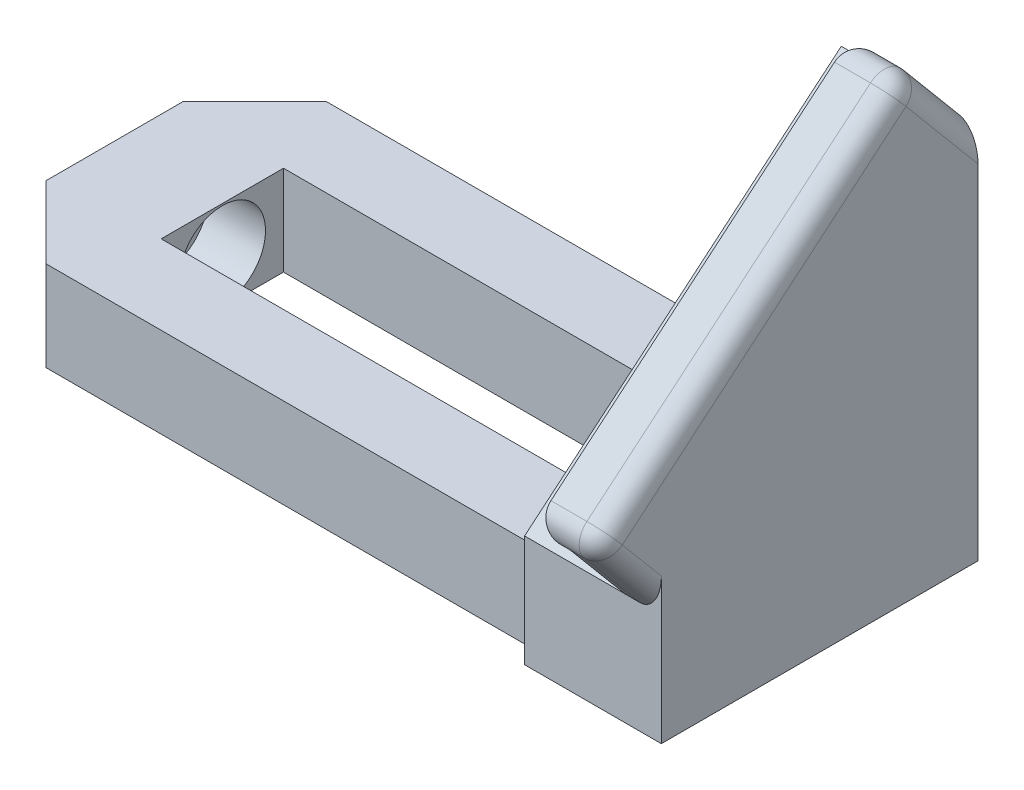
from build123d import *

# Parameters (mm, degrees)
SKETCH1_W                = 64
SKETCH1_H                = 17
BOSS_EXTRUDE1_DEPTH      = 12.5
SKETCH2_R                = 6
CUT_EXTRUDE1_DEPTH       = 8
BOSS_EXTRUDE2_DEPTH      = 3
BOSS_EXTRUDE2_DEPTH_BACK = 12.5
SKETCH3_W                = 19
SKETCH3_H                = 44
BOSS_EXTRUDE3_DEPTH      = 19
BOSS_EXTRUDE4_DEPTH      = 57.437921
FILLET2_R                = 0.5
FILLET3_R                = 3


with BuildPart() as part:
    # Sketch1 → Boss-Extrude1 (new body)
    with BuildSketch(Plane(origin=(0, 0, 0), x_dir=(1, 0, 0), z_dir=(0, 1, 0))):
        Polygon((0, 39), (-88, 39), (-98, 29), (-98, 10), (-88, 0), (0, 0), align=None)
        with Locations((-51, 19.5)):
            Rectangle(SKETCH1_W, SKETCH1_H, mode=Mode.SUBTRACT)
    extrude(amount=BOSS_EXTRUDE1_DEPTH)

    # Sketch2 → Cut-Extrude1 (cut)
    with BuildSketch(Plane(origin=(-83, 0, 0), x_dir=(0, 0, -1), z_dir=(1, 0, 0))):
        with Locations((19.5, 6.25)):
            Circle(SKETCH2_R)
    extrude(amount=-CUT_EXTRUDE1_DEPTH, mode=Mode.SUBTRACT)

    # Sketch3 → Boss-Extrude2 (add, two sides: drawn at the far end of the back side and taken through both)
    with BuildSketch(Plane(origin=(0, 12.5, 0), x_dir=(1, 0, 0), z_dir=(0, 1, 0)).offset(-BOSS_EXTRUDE2_DEPTH_BACK)):
        with Locations((-9.5, 19.5)):
            Rectangle(SKETCH3_W, SKETCH3_H)
    extrude(amount=BOSS_EXTRUDE2_DEPTH + BOSS_EXTRUDE2_DEPTH_BACK)

    # Sketch4 → Boss-Extrude3 (add)
    with BuildSketch(Plane(origin=(0, 0, 0), x_dir=(0, 0, -1), z_dir=(1, 0, 0))):
        Polygon((41.5, 15.5), (41.5, 52.420383772), (-2.5, 15.5), align=None)
    extrude(amount=-BOSS_EXTRUDE3_DEPTH)

    # Sketch5 → Boss-Extrude4 (add)
    with BuildSketch(Plane(origin=(0, 52.420383772, -41.5), x_dir=(1, 0, 0), z_dir=(0, -0.6427876096865353, 0.7660444431189817))):
        Polygon((0, 0), (0, 15), (-8, 15), (-6.5, 12), (-5, 12), (-5, 0), align=None)
    extrude(amount=BOSS_EXTRUDE4_DEPTH)

    # Fillet2
    fillet2_edges = [part.edges().sort_by_distance(p)[0] for p in [
        (-5, 33.960191799, -19.499999897),
        (-5, 43.152725117, -11.786548581),
    ]]
    fillet(fillet2_edges, radius=FILLET2_R)

    # Fillet3
    fillet3_edges = [part.edges().sort_by_distance(p)[0] for p in [
        (-4, 63.911050419, -31.858185855),
        (0, 45.450858446, -9.858185752),
        (-4, 26.990666474, 12.141814352),
        (0, 21.24533315, 7.320907279),
        (0, 58.165717095, -36.679092927),
    ]]
    fillet(fillet3_edges, radius=FILLET3_R - 0.0001)  # a hair under: the kernel refuses the full size


solid = part.part
